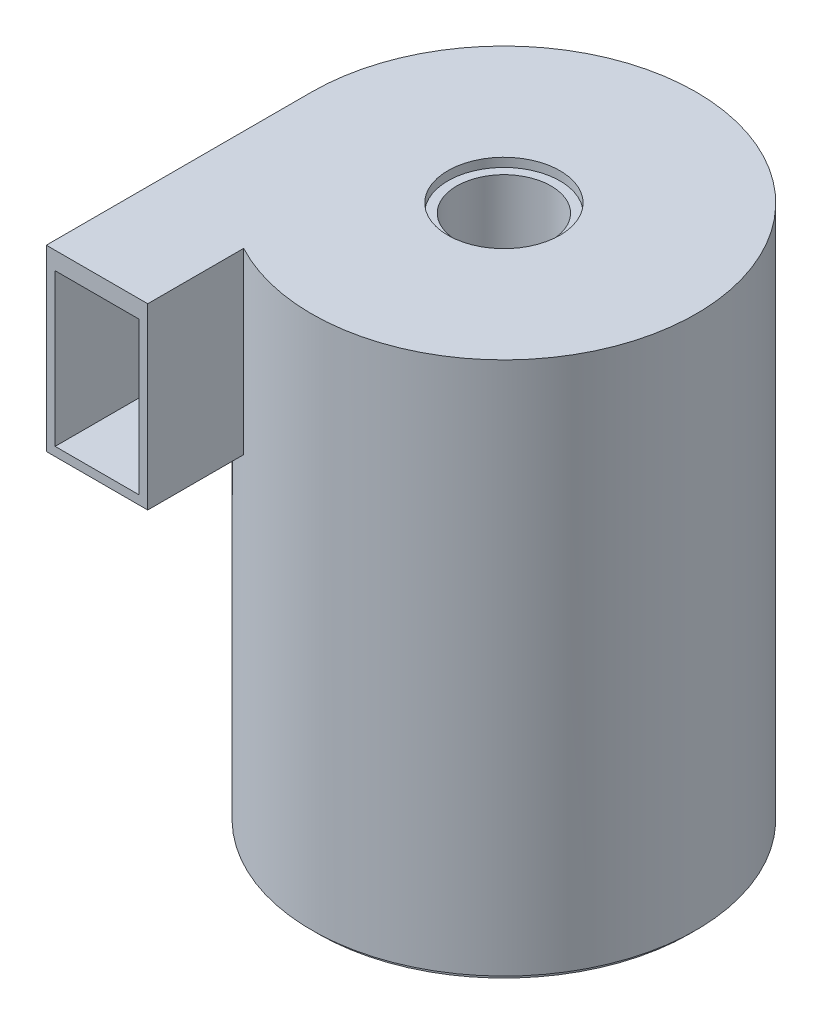
from build123d import *

# Parameters (mm, degrees)
SKETCH_4_W                = 34.4
SKETCH_4_H                = 57.6
EXTRUDE_3_DEPTH           = 90
SHELL_2_OUTLINE_R         = 62.2
SHELL_2_OUTLINE_R_2       = 19
SHELL_2_DEPTH             = 177
SHELL_START               = 125.4
SHELL_2_2_DEPTH           = 51.6
SHELL_2_3_OUTLINE_R       = 19
SHELL_2_3_DEPTH           = 36
EXTRUDE_4_DEPTH           = 3
CUT_EXTRUDE_START         = -3
SKETCH_9_R                = 16
CUT_EXTRUDE_1_DEPTH       = 3
SKETCH_10_R               = 19
CUT_EXTRUDE_2_DEPTH       = 3
CUT_EXTRUDE_START_2       = -2
CUT_EXTRUDE_3_OUTLINE_R   = 65.2
CUT_EXTRUDE_3_OUTLINE_R_2 = 63.2
CUT_EXTRUDE_3_DEPTH       = 2


# Read off the part's stored shape, not the designer's step: 쉘2, 컷-돌출3
with BuildPart() as part:
    # 스케치3 → 회전1 (revolve)
    with BuildSketch(Plane.XY, mode=Mode.PRIVATE) as revolve_1_sk:
        Polygon((0, 36), (16, 36), (16, 180), (65.2, 180), (65.2, 0), (0, 0), align=None)
    revolve(revolve_1_sk.sketch.rotate(Axis((0, 0, 0), (0, 1, 0)), 90), axis=Axis((0, 0, 0), (0, 1, 0)))

    # 스케치4 → 보스-돌출3 (add)
    with BuildSketch(Plane.XY):
        with Locations((-48, 151.2)):
            Rectangle(SKETCH_4_W, SKETCH_4_H)
    extrude(amount=EXTRUDE_3_DEPTH)

    # 쉘2 outline → 쉘2 (cut)
    with BuildSketch(Plane(origin=(0, 0, 0), x_dir=(1, 0, 0), z_dir=(0, 1, 0))):
        Circle(SHELL_2_OUTLINE_R)
        Circle(SHELL_2_OUTLINE_R_2, mode=Mode.SUBTRACT)
    extrude(amount=SHELL_2_DEPTH, mode=Mode.SUBTRACT)

    # Shell 2 2 outline → Shell 2 2 (cut)
    with BuildSketch(Plane(origin=(0, 0, 0), x_dir=(1, 0, 0), z_dir=(0, 1, 0)).offset(SHELL_START)):
        with BuildLine():
            ThreePointArc((-33.8, -52.214940391), (-54.640644213, -29.719353963), (-62.2, 0))
            Line((-62.2, 0), (-62.2, -90))
            Line((-62.2, -90), (-33.8, -90))
            Line((-33.8, -90), (-33.8, -52.214940391))
        make_face()
    extrude(amount=SHELL_2_2_DEPTH, mode=Mode.SUBTRACT)

    # Shell 2 3 outline → Shell 2 3 (cut)
    with BuildSketch(Plane(origin=(0, 0, 0), x_dir=(1, 0, 0), z_dir=(0, 1, 0))):
        Circle(SHELL_2_3_OUTLINE_R)
    extrude(amount=SHELL_2_3_DEPTH, mode=Mode.SUBTRACT)

    # 스케치8 → 보스-돌출4 (add)
    with BuildSketch(Plane(origin=(0, 180, 0), x_dir=(1, 0, 0), z_dir=(0, 1, 0))):
        with BuildLine():
            Line((-30.8, -90), (-30.8, -57.466511987))
            ThreePointArc((-30.8, -57.466511987), (55.942827959, 33.487908266), (-65.2, 0))
            Line((-65.2, 0), (-65.2, -90))
            Line((-65.2, -90), (-30.8, -90))
        make_face()
    extrude(amount=EXTRUDE_4_DEPTH)

    # 스케치9 → 컷-돌출1 (cut)
    with BuildSketch(Plane.XZ.offset(-180).offset(CUT_EXTRUDE_START)):
        with Locations(Location((0, 0, 0), (0, 0, 270))):
            Circle(SKETCH_9_R)
    extrude(amount=CUT_EXTRUDE_1_DEPTH, mode=Mode.SUBTRACT)

    # 스케치10 → 컷-돌출2 (cut)
    with BuildSketch(Plane(origin=(0, 183, 0), x_dir=(1, 0, 0), z_dir=(0, 1, 0)).offset(CUT_EXTRUDE_START)):
        with Locations(Location((0, 0, 0), (0, 0, 270))):
            Circle(SKETCH_10_R)
    extrude(amount=CUT_EXTRUDE_2_DEPTH, mode=Mode.SUBTRACT)

    # 컷-돌출3 outline → 컷-돌출3 (cut)
    with BuildSketch(Plane.XZ.offset(CUT_EXTRUDE_START_2)):
        Circle(CUT_EXTRUDE_3_OUTLINE_R)
        Circle(CUT_EXTRUDE_3_OUTLINE_R_2, mode=Mode.SUBTRACT)
    extrude(amount=CUT_EXTRUDE_3_DEPTH, mode=Mode.SUBTRACT)


solid = part.part
